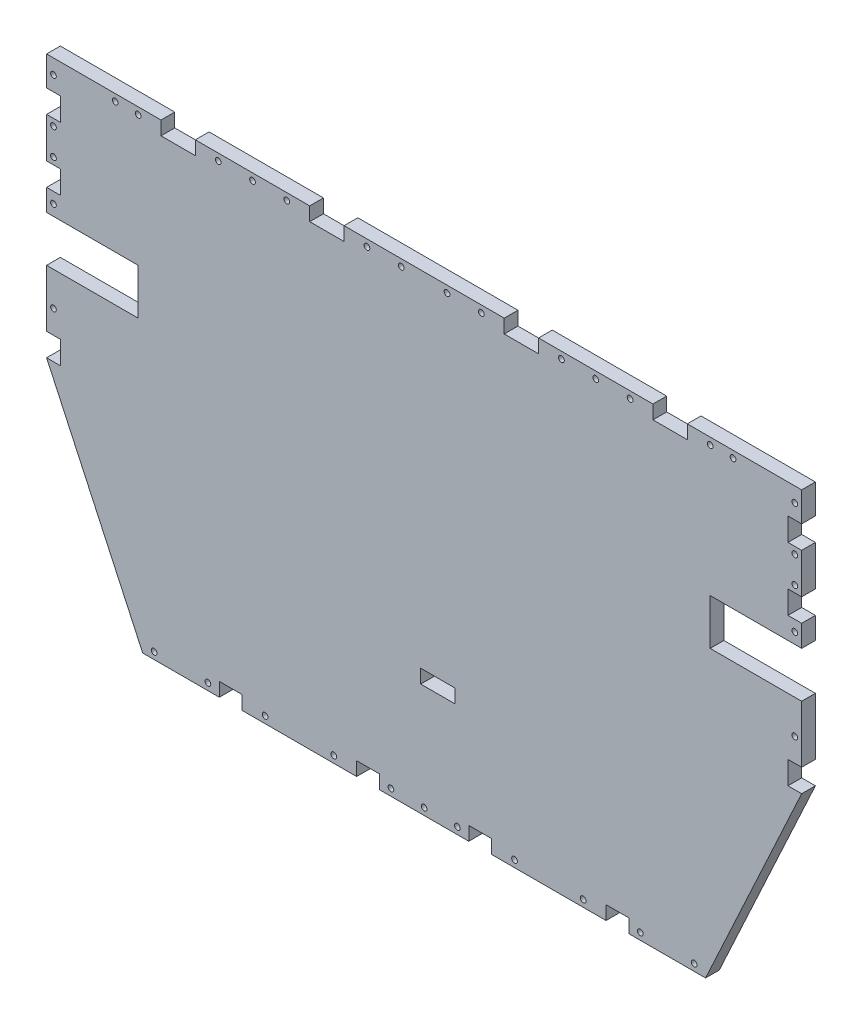
from build123d import *

# Parameters (mm, degrees)
BOSS_EXTRU_1_DEPTH      = 6
ESQUISSE3_W             = 6
ESQUISSE3_H             = 10
ESQUISSE3_W_2           = 10
ESQUISSE3_H_2           = 6
ESQUISSE3_W_3           = 15
ESQUISSE3_W_4           = 40
ESQUISSE3_H_3           = 20
ENL_V_MAT_EXTRU_2_DEPTH = 6
ESQUISSE4_R             = 1.25
ENL_V_MAT_EXTRU_3_DEPTH = 6


with BuildPart() as part:
    # Esquisse1 → Boss.-Extru.1 (new body)
    with BuildSketch(Plane.XY):
        Polygon((-165, 96.73), (165, 96.73), (165, -18.27), (123, -109.022410436), (-123, -109.022410436), (-165, -18.27), align=None)
    extrude(amount=BOSS_EXTRU_1_DEPTH)

    # Esquisse3 → Enlèv. mat.-Extru.2 (cut)
    with BuildSketch(Plane(origin=(0, 0, 0), x_dir=(-1, 0, 0), z_dir=(0, 0, -1))):
        with Locations((162, -13.27)):
            Rectangle(ESQUISSE3_W, ESQUISSE3_H)
        with Locations((162, 78.852589564)):
            Rectangle(ESQUISSE3_W, ESQUISSE3_H)
        with Locations((24.5, -106.022410436)):
            Rectangle(ESQUISSE3_W_2, ESQUISSE3_H_2)
        with Locations((-162, 51.23)):
            Rectangle(ESQUISSE3_W, ESQUISSE3_H)
        with Locations((-24.5, -106.022410436)):
            Rectangle(ESQUISSE3_W_2, ESQUISSE3_H_2)
        with Locations((-162, 78.852589564)):
            Rectangle(ESQUISSE3_W, ESQUISSE3_H)
        with Locations((-162, -13.27)):
            Rectangle(ESQUISSE3_W, ESQUISSE3_H)
        with Locations((107.5, 93.73)):
            Rectangle(ESQUISSE3_W_3, ESQUISSE3_H_2)
        with Locations((-42.5, 93.73)):
            Rectangle(ESQUISSE3_W_3, ESQUISSE3_H_2)
        with Locations((42.5, 93.73)):
            Rectangle(ESQUISSE3_W_3, ESQUISSE3_H_2)
        with Locations((-107.5, 93.73)):
            Rectangle(ESQUISSE3_W_3, ESQUISSE3_H_2)
        with Locations((84.5, -106.022410436)):
            Rectangle(ESQUISSE3_W_2, ESQUISSE3_H_2)
        with Locations((162, 51.23)):
            Rectangle(ESQUISSE3_W, ESQUISSE3_H)
        with Locations((-84.5, -106.022410436)):
            Rectangle(ESQUISSE3_W_2, ESQUISSE3_H_2)
        with Locations((-6, -57.022410436)):
            Rectangle(ESQUISSE3_W_3, ESQUISSE3_H_2)
        with Locations((-145, 26.73)):
            Rectangle(ESQUISSE3_W_4, ESQUISSE3_H_3)
        with Locations((145, 26.73)):
            Rectangle(ESQUISSE3_W_4, ESQUISSE3_H_3)
    extrude(amount=-ENL_V_MAT_EXTRU_2_DEPTH, mode=Mode.SUBTRACT)

    # Esquisse4 → Enlèv. mat.-Extru.3 (cut)
    with BuildSketch(Plane(origin=(0, 0, 0), x_dir=(-1, 0, 0), z_dir=(0, 0, -1))):
        with Locations((162, 1.92)):
            Circle(ESQUISSE4_R)
        with Locations((69.5, -106.022410436)):
            Circle(ESQUISSE4_R)
        with Locations((162, 70.852589564)):
            Circle(ESQUISSE4_R)
        with Locations((0, -106.022410436)):
            Circle(ESQUISSE4_R)
        with Locations((94.5, -106.022410436)):
            Circle(ESQUISSE4_R)
        with Locations((162, 90.29)):
            Circle(ESQUISSE4_R)
        with Locations((-162, 41.48)):
            Circle(ESQUISSE4_R)
        with Locations((14.5, -106.022410436)):
            Circle(ESQUISSE4_R)
        with Locations((118, -106.022410436)):
            Circle(ESQUISSE4_R)
        with Locations((39.5, -106.022410436)):
            Circle(ESQUISSE4_R)
        with Locations((135, 93.73)):
            Circle(ESQUISSE4_R)
        with Locations((125, 93.73)):
            Circle(ESQUISSE4_R)
        with Locations((90, 93.73)):
            Circle(ESQUISSE4_R)
        with Locations((75, 93.73)):
            Circle(ESQUISSE4_R)
        with Locations((60, 93.73)):
            Circle(ESQUISSE4_R)
        with Locations((25, 93.73)):
            Circle(ESQUISSE4_R)
        with Locations((10, 93.73)):
            Circle(ESQUISSE4_R)
        with Locations((-162, 59.23)):
            Circle(ESQUISSE4_R)
        with Locations((-10, 93.73)):
            Circle(ESQUISSE4_R)
        with Locations((-25, 93.73)):
            Circle(ESQUISSE4_R)
        with Locations((-60, 93.73)):
            Circle(ESQUISSE4_R)
        with Locations((-75, 93.73)):
            Circle(ESQUISSE4_R)
        with Locations((-90, 93.73)):
            Circle(ESQUISSE4_R)
        with Locations((-125, 93.73)):
            Circle(ESQUISSE4_R)
        with Locations((-135, 93.73)):
            Circle(ESQUISSE4_R)
        with Locations((-39.5, -106.022410436)):
            Circle(ESQUISSE4_R)
        with Locations((-118, -106.022410436)):
            Circle(ESQUISSE4_R)
        with Locations((-14.5, -106.022410436)):
            Circle(ESQUISSE4_R)
        with Locations((-162, 90.29)):
            Circle(ESQUISSE4_R)
        with Locations((-94.5, -106.022410436)):
            Circle(ESQUISSE4_R)
        with Locations((-162, 70.852589564)):
            Circle(ESQUISSE4_R)
        with Locations((162, 59.23)):
            Circle(ESQUISSE4_R)
        with Locations((162, 41.48)):
            Circle(ESQUISSE4_R)
        with Locations((-69.5, -106.022410436)):
            Circle(ESQUISSE4_R)
        with Locations((-162, 1.92)):
            Circle(ESQUISSE4_R)
    extrude(amount=-ENL_V_MAT_EXTRU_3_DEPTH, mode=Mode.SUBTRACT)


solid = part.part
